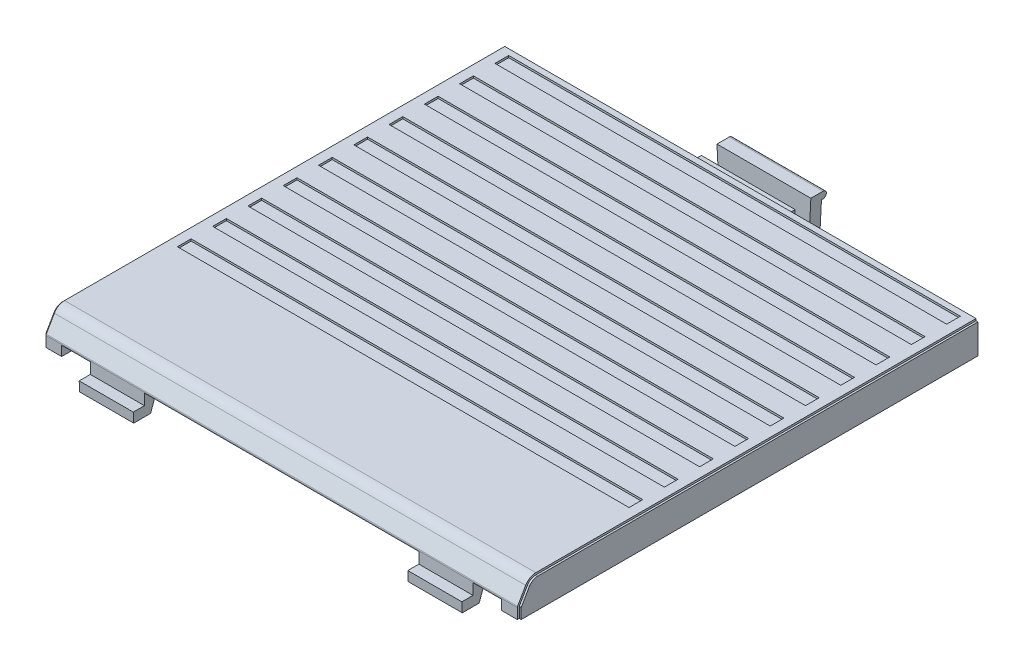
from build123d import *

# Parameters (mm, degrees)
SKETCH1_W           = 60.6
SKETCH1_H           = 58.5
BOSS_EXTRUDE1_DEPTH = 2
SKETCH2_W           = 56.1
SKETCH2_H           = 23.5
SKETCH2_H_2         = 14
CUT_EXTRUDE1_DEPTH  = 1.5
CUT_EXTRUDE2_REACH  = 67.912
SKETCH3_W           = 56.1
SKETCH3_H           = 1.25
BOSS_EXTRUDE2_START = 17.5
BOSS_EXTRUDE2_DEPTH = 6.9
BOSS_EXTRUDE3_DEPTH = 6
DRAFT1_START        = -35
DRAFT1_DEPTH        = 5.75
FILLET1_R           = 0.45
FILLET2_R           = 0.602786
FILLET3_R           = 1.418858
FILLET4_R           = 1
SKETCH6_W           = 57.6
SKETCH6_H           = 1.75
CUT_EXTRUDE3_DEPTH  = 0.25
CHAMFER1_START      = 25.032204955
CHAMFER1_OUTLINE_W  = 60.6
CHAMFER1_OUTLINE_H  = 3
CHAMFER1_DEPTH      = 1.967795045
FILLET5_START       = -31
FILLET5_DEPTH       = 62
FILLET6_R           = 0.25
CUT_SWEEP1_START    = -31
CUT_SWEEP1_DEPTH    = 0.95
CUT_SWEEP1_START_2  = 30.05
CUT_SWEEP1_2_DEPTH  = 0.95


with BuildPart() as part:
    # Sketch1 → Boss-Extrude1 (new, symmetric)
    with BuildSketch(Plane(origin=(0, 0, 0), x_dir=(1, 0, 0), z_dir=(0, 1, 0))):
        Rectangle(SKETCH1_W, SKETCH1_H)
    extrude(amount=BOSS_EXTRUDE1_DEPTH, both=True)

    # Sketch2 → Cut-Extrude1 (cut)
    with BuildSketch(Plane.XZ.offset(2)):
        Rectangle(SKETCH2_W, SKETCH2_H)
        with Locations((0, 20.25)):
            Rectangle(SKETCH2_W, SKETCH2_H_2)
        with Locations((0, -20.25)):
            Rectangle(SKETCH2_W, SKETCH2_H_2)
    extrude(amount=-CUT_EXTRUDE1_DEPTH, mode=Mode.SUBTRACT)

    # Sketch3 → Cut-Extrude2 (cut, up to next)
    with BuildSketch(Plane(origin=(0, 0, -29.25), x_dir=(-1, 0, 0), z_dir=(0, 0, -1)), mode=Mode.PRIVATE) as cut_extrude2_sk1:
        with Locations((0, -1.375)):
            Rectangle(SKETCH3_W, SKETCH3_H)
    cut_extrude2_tool1 = extrude(cut_extrude2_sk1.sketch, amount=-CUT_EXTRUDE2_REACH, mode=Mode.PRIVATE) & part.part
    cut_extrude2 = cut_extrude2_tool1.solids().sort_by_distance((0, -1.375, -29.25))[0]
    add(cut_extrude2, mode=Mode.SUBTRACT)

    # Mirror1: Cut-Extrude2 across plane
    add(cut_extrude2.mirror(Plane.XY), mode=Mode.SUBTRACT)

    # Boss-Extrude2: read off the stored shape, not the designer's step
    # Boss-Extrude2 outline → Boss-Extrude2 (add)
    with BuildSketch(Plane.YZ.offset(BOSS_EXTRUDE2_START)):
        Polygon((-0.75, 29.25), (-2.15, 29.25), (-2.15, 30.669097299), (-3.4, 30.614521121), (-3.4, 28.464521121), (-0.75, 27.5), align=None)
    boss_extrude2 = extrude(amount=BOSS_EXTRUDE2_DEPTH)

    # Sketch5 → Boss-Extrude3 (add, symmetric)
    with BuildSketch(Plane(origin=(0, 0, 0), x_dir=(0, 0, -1), z_dir=(1, 0, 0))):
        Polygon((29.25, 1.5), (30.25, 1.5), (30.25, -9.75), (31.357502325, -9.75), (32.25, -4.75), (32.25, 1.75), (34.25, 1.75), (34.25, 0.85), (33.65, 0.85), (33.65, -4.5), (32.024952176, -11.25), (29.524952176, -11.25), (29.25, -0.75), align=None)
    extrude(amount=BOSS_EXTRUDE3_DEPTH, both=True)

    # Draft1: read off the stored shape, not the designer's step
    # Draft1 outline → Draft1 (cut)
    with BuildSketch(Plane.XY.offset(DRAFT1_START)):
        Polygon((5.305596924, -11.25), (6, -11.25), (6, 1.75), (5.986898055, 1.75), align=None)
        Polygon((-6, -11.25), (-5.305596924, -11.25), (-5.986898055, 1.75), (-6, 1.75), align=None)
    extrude(amount=DRAFT1_DEPTH, mode=Mode.SUBTRACT)

    # Fillet1
    fillet1_edges = [part.edges().sort_by_distance(p)[0] for p in [
        (0, 0.85, -34.25),
        (0, 1.75, -34.25),
    ]]
    fillet(fillet1_edges, radius=FILLET1_R - 0.0001)  # a hair under: the kernel refuses the full size

    # Fillet2
    fillet2_edges = [part.edges().sort_by_distance(p)[0] for p in [
        (0, -9.75, -31.357502325),
        (0, -9.75, -30.25),
    ]]
    fillet(fillet2_edges, radius=FILLET2_R - 0.0001)  # a hair under: the kernel refuses the full size

    # Fillet3
    fillet3_edges = [part.edges().sort_by_distance(p)[0] for p in [
        (0, -11.25, -29.524952176),
        (0, -11.25, -32.024952176),
    ]]
    fillet(fillet3_edges, radius=FILLET3_R - 0.0001)  # a hair under: the kernel refuses the full size

    # Fillet4
    fillet4_edges = [part.edges().sort_by_distance(p)[0] for p in [
        (0, -0.75, -29.25),
    ]]
    fillet(fillet4_edges, radius=FILLET4_R)

    # Sketch6 → Cut-Extrude3 (cut)
    with BuildSketch(Plane(origin=(0, 2, 0), x_dir=(1, 0, 0), z_dir=(0, 1, 0))):
        with Locations((0, 27.625)):
            Rectangle(SKETCH6_W, SKETCH6_H)
        with Locations((0, 23.125)):
            Rectangle(SKETCH6_W, SKETCH6_H)
        with Locations((0, 18.625)):
            Rectangle(SKETCH6_W, SKETCH6_H)
        with Locations((0, 14.125)):
            Rectangle(SKETCH6_W, SKETCH6_H)
        with Locations((0, 9.625)):
            Rectangle(SKETCH6_W, SKETCH6_H)
        with Locations((0, 5.125)):
            Rectangle(SKETCH6_W, SKETCH6_H)
        with Locations((0, 0.625)):
            Rectangle(SKETCH6_W, SKETCH6_H)
        with Locations((0, -3.875)):
            Rectangle(SKETCH6_W, SKETCH6_H)
        with Locations((0, -8.375)):
            Rectangle(SKETCH6_W, SKETCH6_H)
        with Locations((0, -12.875)):
            Rectangle(SKETCH6_W, SKETCH6_H)
    extrude(amount=-CUT_EXTRUDE3_DEPTH, mode=Mode.SUBTRACT)

    # Chamfer1: read off the stored shape, not the designer's step
    # Chamfer1 outline → Chamfer1 (cut)
    with BuildSketch(Plane(origin=(0, 0, 0), x_dir=(1, 0, 0), z_dir=(0, 0.500000000000001, 0.866025403784438)).offset(CHAMFER1_START)):
        with Locations((0, -13.642949192)):
            Rectangle(CHAMFER1_OUTLINE_W, CHAMFER1_OUTLINE_H)
    extrude(amount=CHAMFER1_DEPTH, mode=Mode.SUBTRACT)

    # Fillet5: read off the stored shape, not the designer's step
    # Fillet5 outline → Fillet5 (cut)
    with BuildSketch(Plane.YZ.offset(FILLET5_START)):
        with BuildLine():
            ThreePointArc((1.25, 28.183012702), (1.799038106, 27.633974596), (2, 26.883974596))
            Line((2, 26.883974596), (2, 27.75))
            Line((2, 27.75), (1.25, 28.183012702))
        make_face()
    extrude(amount=FILLET5_DEPTH, mode=Mode.SUBTRACT)

    # Fillet6
    fillet6_edges = [part.edges().sort_by_distance(p)[0] for p in [
        (0, -0.598076211, 29.25),
    ]]
    fillet(fillet6_edges, radius=FILLET6_R)

    # Cut-Sweep1: read off the stored shape, not the designer's step
    # Cut-Sweep1 outline → Cut-Sweep1 (cut)
    with BuildSketch(Plane.YZ.offset(CUT_SWEEP1_START)):
        with BuildLine():
            ThreePointArc((1.125, 27.966506351), (1.582531755, 27.508974596), (1.75, 26.883974596))
            Line((1.75, 26.883974596), (1.75, -29.25))
            Line((1.75, -29.25), (2, -29.25))
            Line((2, -29.25), (2, 26.883974596))
            ThreePointArc((2, 26.883974596), (1.799038106, 27.633974596), (1.25, 28.183012702))
            Line((1.25, 28.183012702), (-0.540063509, 29.216506351))
            ThreePointArc((-0.540063509, 29.216506351), (-0.600358748, 29.241481457), (-0.665063509, 29.25))
            Line((-0.665063509, 29.25), (-2, 29.25))
            Line((-2, 29.25), (-2, 29))
            Line((-2, 29), (-0.665063509, 29))
            Line((-0.665063509, 29), (1.125, 27.966506351))
        make_face()
    extrude(amount=CUT_SWEEP1_DEPTH, mode=Mode.SUBTRACT)

    # Cut-Sweep1 2 outline → Cut-Sweep1 2 (cut)
    with BuildSketch(Plane.YZ.offset(CUT_SWEEP1_START_2)):
        with BuildLine():
            ThreePointArc((1.125, 27.966506351), (1.582531755, 27.508974596), (1.75, 26.883974596))
            Line((1.75, 26.883974596), (1.75, -29.25))
            Line((1.75, -29.25), (2, -29.25))
            Line((2, -29.25), (2, 26.883974596))
            ThreePointArc((2, 26.883974596), (1.799038106, 27.633974596), (1.25, 28.183012702))
            Line((1.25, 28.183012702), (-0.540063509, 29.216506351))
            ThreePointArc((-0.540063509, 29.216506351), (-0.600358748, 29.241481457), (-0.665063509, 29.25))
            Line((-0.665063509, 29.25), (-2, 29.25))
            Line((-2, 29.25), (-2, 29))
            Line((-2, 29), (-0.665063509, 29))
            Line((-0.665063509, 29), (1.125, 27.966506351))
        make_face()
    extrude(amount=CUT_SWEEP1_2_DEPTH, mode=Mode.SUBTRACT)

    # Mirror2: Boss-Extrude2 across plane
    add(boss_extrude2.mirror(Plane(origin=(0, 0, 0), x_dir=(0, 0, 1), z_dir=(1, 0, 0))))


solid = part.part
